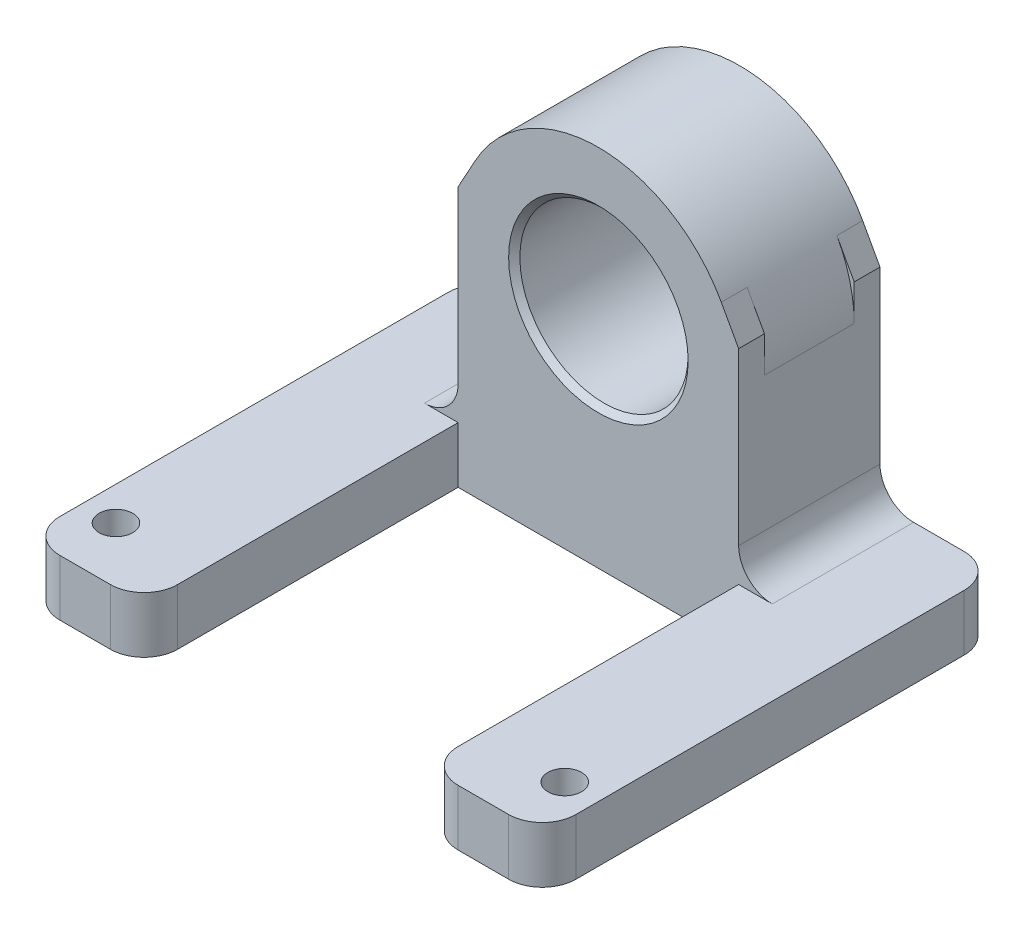
from build123d import *

# Parameters (mm, degrees)
SKETCH_1_R           = 7.5
EXTRUDE_1_DEPTH      = 6.3
CUT_EXTRUDE_1_DEPTH  = 4
SKETCH_3_R           = 2
CUT_EXTRUDE_2_DEPTH  = 41.027365639
CHAMFER_1_SIZE       = 0.5
EXTRUDE_2_DEPTH      = 28
EXTRUDE_2_DEPTH_BACK = 12.6
SKETCH_5_R           = 1.5
CUT_EXTRUDE_3_DEPTH  = 46.885618662
SKETCH_6_W           = 25
SKETCH_6_H           = 28
CUT_EXTRUDE_4_DEPTH  = 46.885618662
SKETCH_7_W           = 10
SKETCH_7_H           = 22.359066313
SKETCH_7_W_2         = 10.5
SKETCH_7_H_2         = 23.032343059
CUT_EXTRUDE_5_DEPTH  = 42.388404173
FILLET_1_R           = 3


with BuildPart() as part:
    # 草图1 → 凸台-拉伸1 (new, symmetric)
    with BuildSketch(Plane.XY):
        with BuildLine():
            Line((-22.5, -20), (22.5, -20))
            Line((22.5, -20), (22.5, -15))
            Line((22.5, -15), (10.956194261, 6.017624724))
            ThreePointArc((10.956194261, 6.017624724), (0, 12.5), (-10.956194261, 6.017624724))
            Line((-10.956194261, 6.017624724), (-22.5, -15))
            Line((-22.5, -15), (-22.5, -20))
        make_face()
        Circle(SKETCH_1_R, mode=Mode.SUBTRACT)
    extrude(amount=EXTRUDE_1_DEPTH, both=True)

    # 草图2 → 切除-拉伸1 (cut, symmetric)
    with BuildSketch(Plane.XY):
        with BuildLine():
            Line((22.5, -15), (12.5, -15))
            Line((12.5, -15), (12.5, 0))
            ThreePointArc((12.5, 0), (12.107898832, 3.106249486), (10.956194261, 6.017624724))
            Line((10.956194261, 6.017624724), (22.5, -15))
        make_face()
        with BuildLine():
            Line((-22.5, -15), (-12.5, -15))
            Line((-12.5, -15), (-12.5, 0))
            ThreePointArc((-12.5, 0), (-12.107898832, 3.106249486), (-10.956194261, 6.017624724))
            Line((-10.956194261, 6.017624724), (-22.5, -15))
        make_face()
    extrude(amount=CUT_EXTRUDE_1_DEPTH, both=True, mode=Mode.SUBTRACT)

    # 草图3 → 切除-拉伸2 (cut, through all)
    with BuildSketch(Plane.XZ.offset(20)):
        with Locations((17.5, 0)):
            Circle(SKETCH_3_R)
        with Locations((-17.5, 0)):
            Circle(SKETCH_3_R)
    extrude(amount=-CUT_EXTRUDE_2_DEPTH, mode=Mode.SUBTRACT)

    # 倒角1
    chamfer_1_edges = [part.edges().sort_by_distance(p)[0] for p in [
        (-7.5, 0, -6.3),
        (-7.5, 0, 6.3),
    ]]
    chamfer(chamfer_1_edges, length=CHAMFER_1_SIZE)

    # 草图4 → 凸台-拉伸2 (add, two sides: drawn at the far end of the back side and taken through both)
    with BuildSketch(Plane.XY.offset(6.3).offset(-EXTRUDE_2_DEPTH_BACK)):
        Polygon((-22.5, -15), (-23, -15), (-23, -20), (-22.5, -20), (23, -20), (23, -15), align=None)
    extrude(amount=EXTRUDE_2_DEPTH + EXTRUDE_2_DEPTH_BACK)

    # 草图5 → 切除-拉伸3 (cut, through all)
    with BuildSketch(Plane(origin=(0, 0, 0), x_dir=(1, 0, 0), z_dir=(0, 1, 0))):
        with Locations((-20, -29.3)):
            Circle(SKETCH_5_R)
        with Locations((20, -29.3)):
            Circle(SKETCH_5_R)
    extrude(amount=-CUT_EXTRUDE_3_DEPTH, mode=Mode.SUBTRACT)

    # 草图6 → 切除-拉伸4 (cut, through all)
    with BuildSketch(Plane(origin=(0, 0, 0), x_dir=(1, 0, 0), z_dir=(0, 1, 0))):
        with Locations((0, -20.3)):
            Rectangle(SKETCH_6_W, SKETCH_6_H)
    extrude(amount=-CUT_EXTRUDE_4_DEPTH, mode=Mode.SUBTRACT)

    # 草图7 → 切除-拉伸5 (cut, through all)
    with BuildSketch(Plane.XY.offset(6.3)):
        with Locations((-17.5, -3.820466844)):
            Rectangle(SKETCH_7_W, SKETCH_7_H)
        with Locations((17.75, -3.483828471)):
            Rectangle(SKETCH_7_W_2, SKETCH_7_H_2)
    extrude(amount=-CUT_EXTRUDE_5_DEPTH, mode=Mode.SUBTRACT)

    # 圆角1
    fillet_1_edges = [part.edges().sort_by_distance(p)[0] for p in [
        (-12.5, -15, 0),
        (12.5, -15, 0),
    ]]
    fillet(fillet_1_edges, radius=FILLET_1_R)
    fillet_1_2_edges = [part.edges().sort_by_distance(p)[0] for p in [
        (23, -17.5, -6.3),
        (-23, -17.5, -6.3),
        (-23, -17.5, 34.3),
        (-12.5, -17.5, 34.3),
        (12.5, -17.5, 34.3),
        (23, -17.5, 34.3),
    ]]
    fillet(fillet_1_2_edges, radius=FILLET_1_R)


solid = part.part
